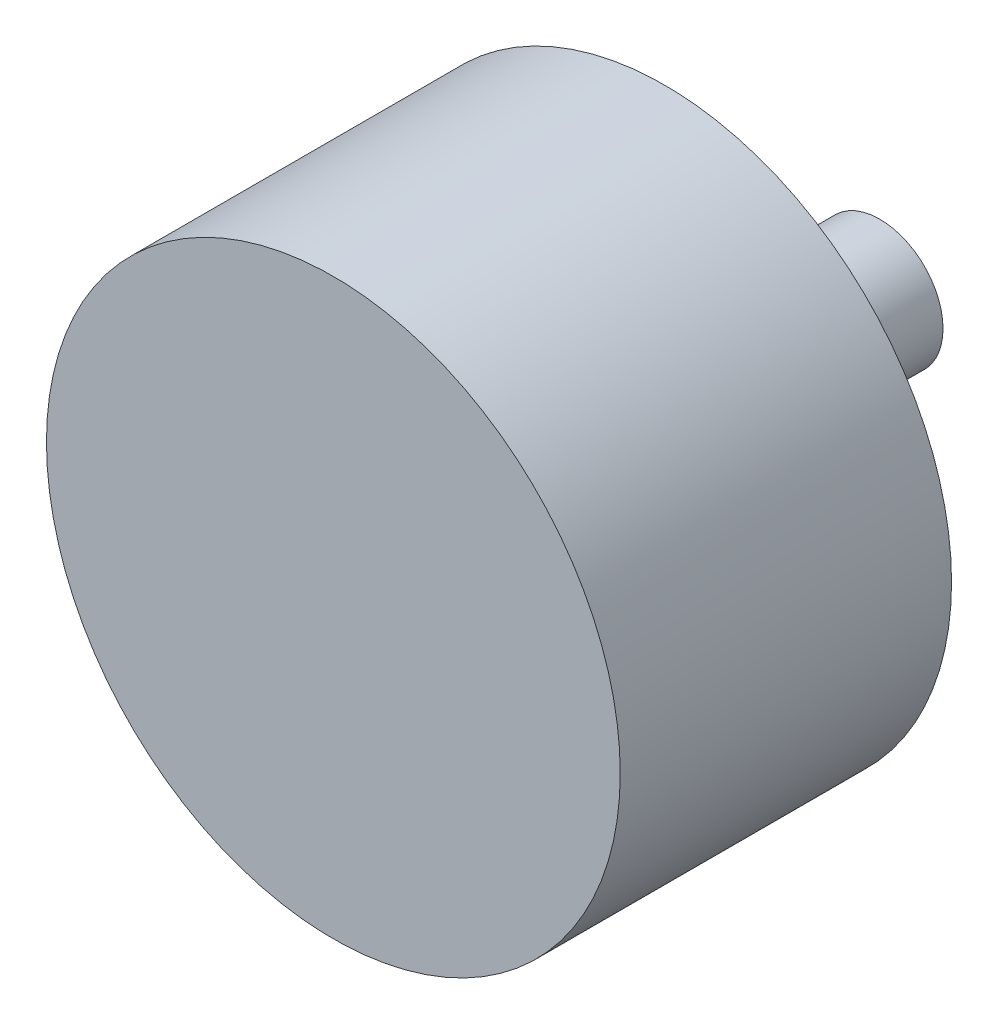
from build123d import *


with BuildPart() as part:
    # Sketch1 → Revolve1 (revolve)
    with BuildSketch(Plane(origin=(0, 0, 0), x_dir=(0, 0, -1), z_dir=(1, 0, 0))):
        Polygon((0, 0), (0, 21.336), (24.638, 21.336), (24.638, 5.461), (30.48, 5.461), (30.48, 4.699), (40.64, 4.699), (40.64, 0), align=None)
    revolve(axis=Axis((0, 0, 0), (0, 0, -1)))


solid = part.part
